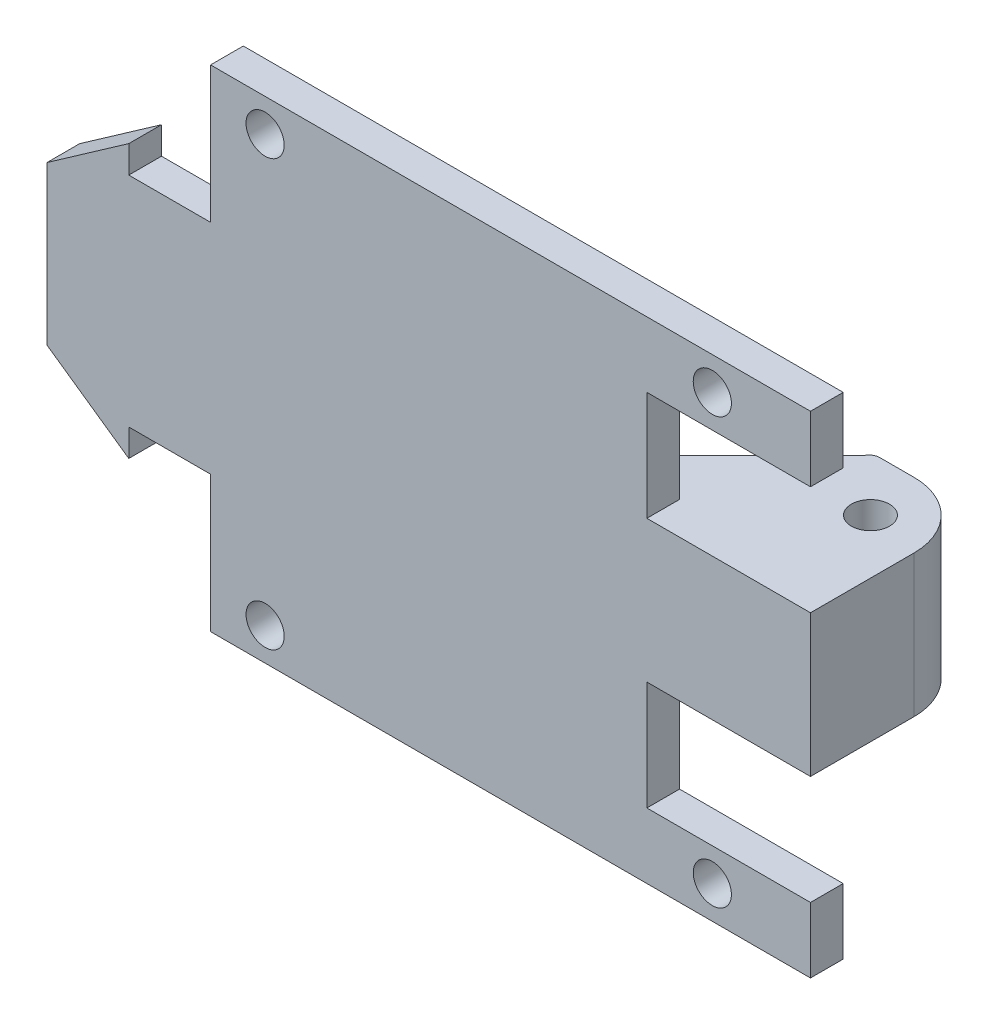
from build123d import *

# Parameters (mm, degrees)
SKETCH1_W           = 55
SKETCH1_H           = 45
BOSS_EXTRUDE1_DEPTH = 3
SKETCH2_W           = 10
SKETCH2_H           = 13
BOSS_EXTRUDE2_DEPTH = 12.5
SKETCH3_R           = 1.75
CUT_EXTRUDE1_DEPTH  = 13.5
FILLET1_R           = 6
CHAMFER1_SIZE       = 12
FILLET3_R           = 1
SKETCH4_W           = 20
SKETCH4_H           = 10
CUT_EXTRUDE3_DEPTH  = 5
SKETCH7_R           = 1.75
CUT_EXTRUDE4_DEPTH  = 5
BOSS_EXTRUDE4_DEPTH = 3


with BuildPart() as part:
    # Sketch1 → Boss-Extrude1 (new body)
    with BuildSketch(Plane.XY):
        with Locations((-16.936997319, -3.156836461)):
            Rectangle(SKETCH1_W, SKETCH1_H)
    extrude(amount=BOSS_EXTRUDE1_DEPTH)

    # Sketch2 → Boss-Extrude2 (add)
    with BuildSketch(Plane(origin=(0, 0, 0), x_dir=(-1, 0, 0), z_dir=(0, 0, -1))):
        with Locations((-5.563002681, -3.156836461)):
            Rectangle(SKETCH2_W, SKETCH2_H)
    extrude(amount=BOSS_EXTRUDE2_DEPTH)

    # Sketch3 → Cut-Extrude1 (cut)
    with BuildSketch(Plane(origin=(0, 3.343163539, 0), x_dir=(1, 0, 0), z_dir=(0, 1, 0))):
        with Locations(Location((5.563002681, 7.5, 0), (0, 0, 180))):
            Circle(SKETCH3_R)
    extrude(amount=-CUT_EXTRUDE1_DEPTH, mode=Mode.SUBTRACT)

    # Fillet1
    fillet1_edges = [part.edges().sort_by_distance(p)[0] for p in [
        (10.563002681, -3.156836461, -12.5),
    ]]
    fillet(fillet1_edges, radius=FILLET1_R)

    # Chamfer1
    chamfer1_edges = [part.edges().sort_by_distance(p)[0] for p in [
        (0.563002681, -3.156836461, 0),
    ]]
    chamfer(chamfer1_edges, length=CHAMFER1_SIZE)

    # Fillet3
    # the kernel refuses this fillet: 1 mm, written as the material it takes off along each edge
    with BuildSketch(Plane(origin=(0.563002681, 5.508227048, -12.5), x_dir=(1, 0, 0), z_dir=(0, -1, 0))) as fillet3_piece_1:
        with BuildLine():
            CenterArc((0.866025404, 1), FILLET3_R, 210, 60)
            Line((0, 0.5), (-0.017320508, 0.49))
            ThreePointArc((-0.017320508, 0.49), (-0.02, 0.25), (-0.02, 0))
            Line((-0.02, 0), (0, -0.02))
            Line((0, -0.02), (0.866025404, -0.02))
            Line((0.866025404, -0.02), (0.866025404, 0))
        make_face()
    extrude(amount=17.330127019, mode=Mode.SUBTRACT)

    # Sketch4 → Cut-Extrude3 (cut)
    with BuildSketch(Plane(origin=(0, 0, 0), x_dir=(-1, 0, 0), z_dir=(0, 0, -1))):
        with Locations((-5.563002681, 8.343163539)):
            Rectangle(SKETCH4_W, SKETCH4_H)
    cut_extrude3 = extrude(amount=-CUT_EXTRUDE3_DEPTH, mode=Mode.SUBTRACT)

    # Mirror2: Cut-Extrude3 across plane
    add(cut_extrude3.mirror(Plane.ZX.offset(-3.156836461)), mode=Mode.SUBTRACT)

    # Sketch7 → Cut-Extrude4 (cut)
    with BuildSketch(Plane(origin=(0, 0, 0), x_dir=(-1, 0, 0), z_dir=(0, 0, -1))):
        with Locations((-1.563002681, 16.343163539)):
            Circle(SKETCH7_R)
        with Locations((39.436997319, 16.343163539)):
            Circle(SKETCH7_R)
        with Locations(Location((39.436997319, -22.656836461, 0), (0, 0, 180))):
            Circle(SKETCH7_R)
        with Locations(Location((-1.563002681, -22.656836461, 0), (0, 0, 180))):
            Circle(SKETCH7_R)
    extrude(amount=-CUT_EXTRUDE4_DEPTH, mode=Mode.SUBTRACT)

    # Sketch8 → Boss-Extrude4 (add)
    with BuildSketch(Plane(origin=(0, 0, 0), x_dir=(-1, 0, 0), z_dir=(0, 0, -1))):
        Polygon((44.436997319, 6.843163539), (51.936997319, 6.843163539), (51.936997319, 9.343163539), (59.436997319, 4.091607002), (59.436997319, -10.405279925), (51.936997319, -15.656836461), (51.936997319, -13.156836461), (44.436997319, -13.156836461), align=None)
    extrude(amount=-BOSS_EXTRUDE4_DEPTH)


solid = part.part
